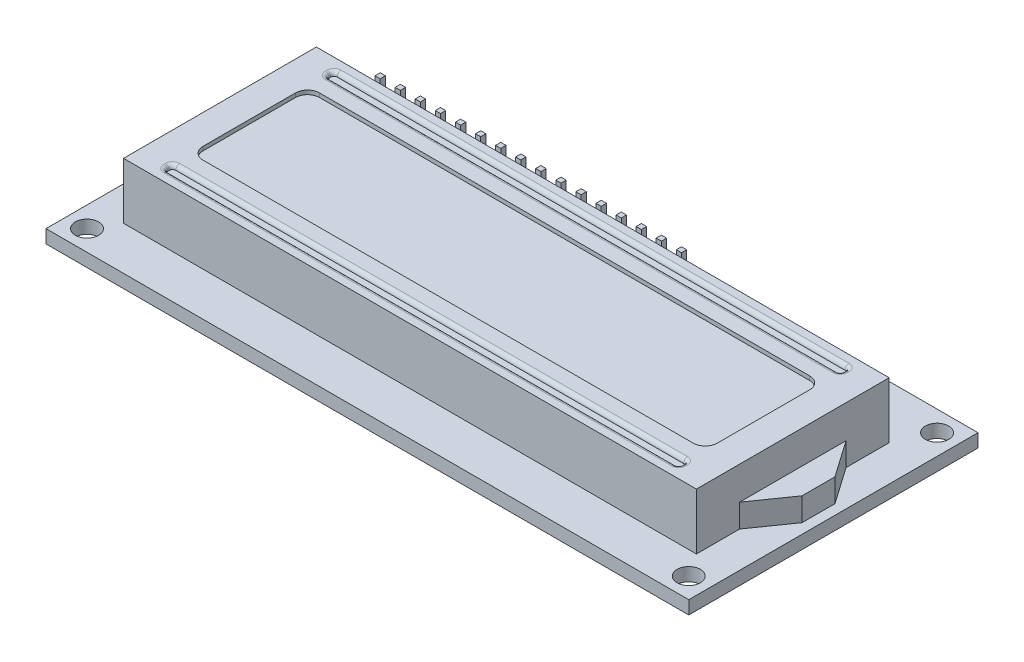
from build123d import *

# Parameters (mm, degrees)
SKETCH1_W              = 80
SKETCH1_H              = 36
BOSS_EXTRUDE1_DEPTH    = 1.65
SKETCH2_W              = 71.3
SKETCH2_H              = 24
BOSS_EXTRUDE2_DEPTH    = 7
BOSS_EXTRUDE3_START    = -5
SKETCH3_W              = 0.65
SKETCH3_H              = 0.65
BOSS_EXTRUDE3_DEPTH    = 8.8
FILLET1_R              = 0.5
LPATTERN1_COUNT        = 16
LPATTERN1_PITCH        = 2.5
FILLET1_OF_LPATTERN1_R = 0.5
CUT_EXTRUDE1_DEPTH     = 0.5
FILLET3_R              = 0.5
BOSS_EXTRUDE4_DEPTH    = 2.9
SKETCH6_R              = 1.45
CUT_EXTRUDE2_DEPTH     = 83.298238134
BOSS_EXTRUDE7_DEPTH    = 2.35


with BuildPart() as part:
    # Sketch1 → Boss-Extrude1 (new body)
    with BuildSketch(Plane(origin=(0, 0, 0), x_dir=(1, 0, 0), z_dir=(0, 1, 0))):
        with Locations((40, 0)):
            Rectangle(SKETCH1_W, SKETCH1_H)
    extrude(amount=BOSS_EXTRUDE1_DEPTH)

    # Sketch2 → Boss-Extrude2 (add)
    with BuildSketch(Plane(origin=(0, 1.65, 0), x_dir=(1, 0, 0), z_dir=(0, 1, 0))):
        with Locations((39.9, -0.6)):
            Rectangle(SKETCH2_W, SKETCH2_H)
    extrude(amount=BOSS_EXTRUDE2_DEPTH)

    # Sketch3 → Boss-Extrude3 (add)
    with BuildSketch(Plane(origin=(0, 1.65, 0), x_dir=(1, 0, 0), z_dir=(0, 1, 0)).offset(BOSS_EXTRUDE3_START)):
        with Locations((8.125, 15.475)):
            Rectangle(SKETCH3_W, SKETCH3_H)
    boss_extrude3 = extrude(amount=BOSS_EXTRUDE3_DEPTH)

    # Fillet1
    fillet1_edges = [part.edges().sort_by_distance(p)[0] for p in [
        (7.8, 1.65, -15.475),
        (8.125, 1.65, -15.8),
        (8.45, 1.65, -15.475),
        (8.125, 1.65, -15.15),
    ]]
    fillet(fillet1_edges, radius=FILLET1_R)

    # LPattern1: Boss-Extrude3 ×16
    with Locations(*[(i * LPATTERN1_PITCH, 0, 0) for i in range(1, LPATTERN1_COUNT)]):
        add(boss_extrude3)

    # Fillet1 of LPattern1
    fillet1_of_lpattern1_edges = [part.edges().sort_by_distance(p)[0] for p in [
        (10.3, 1.65, -15.475),
        (10.625, 1.65, -15.8),
        (10.95, 1.65, -15.475),
        (10.625, 1.65, -15.15),
        (12.8, 1.65, -15.475),
        (13.125, 1.65, -15.8),
        (13.45, 1.65, -15.475),
        (13.125, 1.65, -15.15),
        (15.3, 1.65, -15.475),
        (15.625, 1.65, -15.8),
        (15.95, 1.65, -15.475),
        (15.625, 1.65, -15.15),
        (17.8, 1.65, -15.475),
        (18.125, 1.65, -15.8),
        (18.45, 1.65, -15.475),
        (18.125, 1.65, -15.15),
        (20.3, 1.65, -15.475),
        (20.625, 1.65, -15.8),
        (20.95, 1.65, -15.475),
        (20.625, 1.65, -15.15),
        (22.8, 1.65, -15.475),
        (23.125, 1.65, -15.8),
        (23.45, 1.65, -15.475),
        (23.125, 1.65, -15.15),
        (25.3, 1.65, -15.475),
        (25.625, 1.65, -15.8),
        (25.95, 1.65, -15.475),
        (25.625, 1.65, -15.15),
        (27.8, 1.65, -15.475),
        (28.125, 1.65, -15.8),
        (28.45, 1.65, -15.475),
        (28.125, 1.65, -15.15),
        (30.3, 1.65, -15.475),
        (30.625, 1.65, -15.8),
        (30.95, 1.65, -15.475),
        (30.625, 1.65, -15.15),
        (32.8, 1.65, -15.475),
        (33.125, 1.65, -15.8),
        (33.45, 1.65, -15.475),
        (33.125, 1.65, -15.15),
        (35.3, 1.65, -15.475),
        (35.625, 1.65, -15.8),
        (35.95, 1.65, -15.475),
        (35.625, 1.65, -15.15),
        (37.8, 1.65, -15.475),
        (38.125, 1.65, -15.8),
        (38.45, 1.65, -15.475),
        (38.125, 1.65, -15.15),
        (40.3, 1.65, -15.475),
        (40.625, 1.65, -15.8),
        (40.95, 1.65, -15.475),
        (40.625, 1.65, -15.15),
        (42.8, 1.65, -15.475),
        (43.125, 1.65, -15.8),
        (43.45, 1.65, -15.475),
        (43.125, 1.65, -15.15),
        (45.3, 1.65, -15.475),
        (45.625, 1.65, -15.8),
        (45.95, 1.65, -15.475),
        (45.625, 1.65, -15.15),
    ]]
    fillet(fillet1_of_lpattern1_edges, radius=FILLET1_OF_LPATTERN1_R)

    # Sketch4 → Cut-Extrude1 (cut)
    with BuildSketch(Plane(origin=(0, 8.65, 0), x_dir=(1, 0, 0), z_dir=(0, 1, 0))):
        with BuildLine():
            Line((9.4, 6.65), (70.4, 6.65))
            ThreePointArc((70.4, 6.65), (71.460660172, 6.210660172), (71.9, 5.15))
            Line((71.9, 5.15), (71.9, -6.35))
            ThreePointArc((71.9, -6.35), (71.460660172, -7.410660172), (70.4, -7.85))
            Line((70.4, -7.85), (9.4, -7.85))
            ThreePointArc((9.4, -7.85), (8.339339828, -7.410660172), (7.9, -6.35))
            Line((7.9, -6.35), (7.9, 5.15))
            ThreePointArc((7.9, 5.15), (8.339339828, 6.210660172), (9.4, 6.65))
        make_face()
        with BuildLine():
            Line((8.3, 9.95), (71.5, 9.95))
            ThreePointArc((71.5, 9.95), (71.782842712, 9.832842712), (71.9, 9.55))
            Line((71.9, 9.55), (71.9, 9.35))
            ThreePointArc((71.9, 9.35), (71.782842712, 9.067157288), (71.5, 8.95))
            Line((71.5, 8.95), (8.3, 8.95))
            ThreePointArc((8.3, 8.95), (8.017157288, 9.067157288), (7.9, 9.35))
            Line((7.9, 9.35), (7.9, 9.55))
            ThreePointArc((7.9, 9.55), (8.017157288, 9.832842712), (8.3, 9.95))
        make_face()
        with BuildLine():
            Line((8.3, -10.15), (71.5, -10.15))
            ThreePointArc((71.5, -10.15), (71.782842712, -10.267157288), (71.9, -10.55))
            Line((71.9, -10.55), (71.9, -10.75))
            ThreePointArc((71.9, -10.75), (71.782842712, -11.032842712), (71.5, -11.15))
            Line((71.5, -11.15), (8.3, -11.15))
            ThreePointArc((8.3, -11.15), (8.017157288, -11.032842712), (7.9, -10.75))
            Line((7.9, -10.75), (7.9, -10.55))
            ThreePointArc((7.9, -10.55), (8.017157288, -10.267157288), (8.3, -10.15))
        make_face()
    extrude(amount=-CUT_EXTRUDE1_DEPTH, mode=Mode.SUBTRACT)

    # Fillet3
    fillet3_edges = [part.edges().sort_by_distance(p)[0] for p in [
        (71.782842712, 8.65, 10.267157288),
        (71.9, 8.65, 10.65),
        (71.782842712, 8.65, 11.032842712),
        (39.9, 8.65, 11.15),
        (8.017157288, 8.65, 11.032842712),
        (7.9, 8.65, 10.65),
        (8.017157288, 8.65, 10.267157288),
        (71.782842712, 8.65, -9.832842712),
        (71.9, 8.65, -9.45),
        (71.782842712, 8.65, -9.067157288),
        (39.9, 8.65, -8.95),
        (8.017157288, 8.65, -9.067157288),
        (7.9, 8.65, -9.45),
        (8.017157288, 8.65, -9.832842712),
        (39.9, 8.65, 10.15),
        (39.9, 8.65, -9.95),
    ]]
    fillet(fillet3_edges, radius=FILLET3_R - 0.0001)  # a hair under: the kernel refuses the full size

    # Sketch5 → Boss-Extrude4 (add)
    with BuildSketch(Plane(origin=(0, 1.65, 0), x_dir=(1, 0, 0), z_dir=(0, 1, 0))):
        Polygon((75.55, 6.025), (75.55, -7.225), (78.75, -2.65), (78.75, 1.45), align=None)
    extrude(amount=BOSS_EXTRUDE4_DEPTH)

    # Sketch6 → Cut-Extrude2 (cut, through all)
    with BuildSketch(Plane(origin=(0, 1.65, 0), x_dir=(1, 0, 0), z_dir=(0, 1, 0))):
        with Locations(Location((2.55, 15.45, 0), (0, 0, 270))):
            Circle(SKETCH6_R)
        with Locations(Location((77.45, 15.45, 0), (0, 0, 270))):
            Circle(SKETCH6_R)
        with Locations(Location((77.45, -15.45, 0), (0, 0, 90))):
            Circle(SKETCH6_R)
        with Locations(Location((2.55, -15.45, 0), (0, 0, 90))):
            Circle(SKETCH6_R)
    extrude(amount=-CUT_EXTRUDE2_DEPTH, mode=Mode.SUBTRACT)

    # Sketch9 → Boss-Extrude7 (add)
    with BuildSketch(Plane.XZ):
        Polygon((73.21035645, -9.446296981), (72.75, -7.5), (66.181247689, -9.053703019), (66.641604139, -11), align=None)
        Polygon((73.21035645, 10.553703019), (72.75, 12.5), (66.181247689, 10.946296981), (66.641604139, 9), align=None)
        Polygon((44.21035645, 10.553703019), (43.75, 12.5), (37.181247689, 10.946296981), (37.641604139, 9), align=None)
        Polygon((15.21035645, 10.553703019), (14.75, 12.5), (8.181247689, 10.946296981), (8.641604139, 9), align=None)
    extrude(amount=BOSS_EXTRUDE7_DEPTH)


solid = part.part
